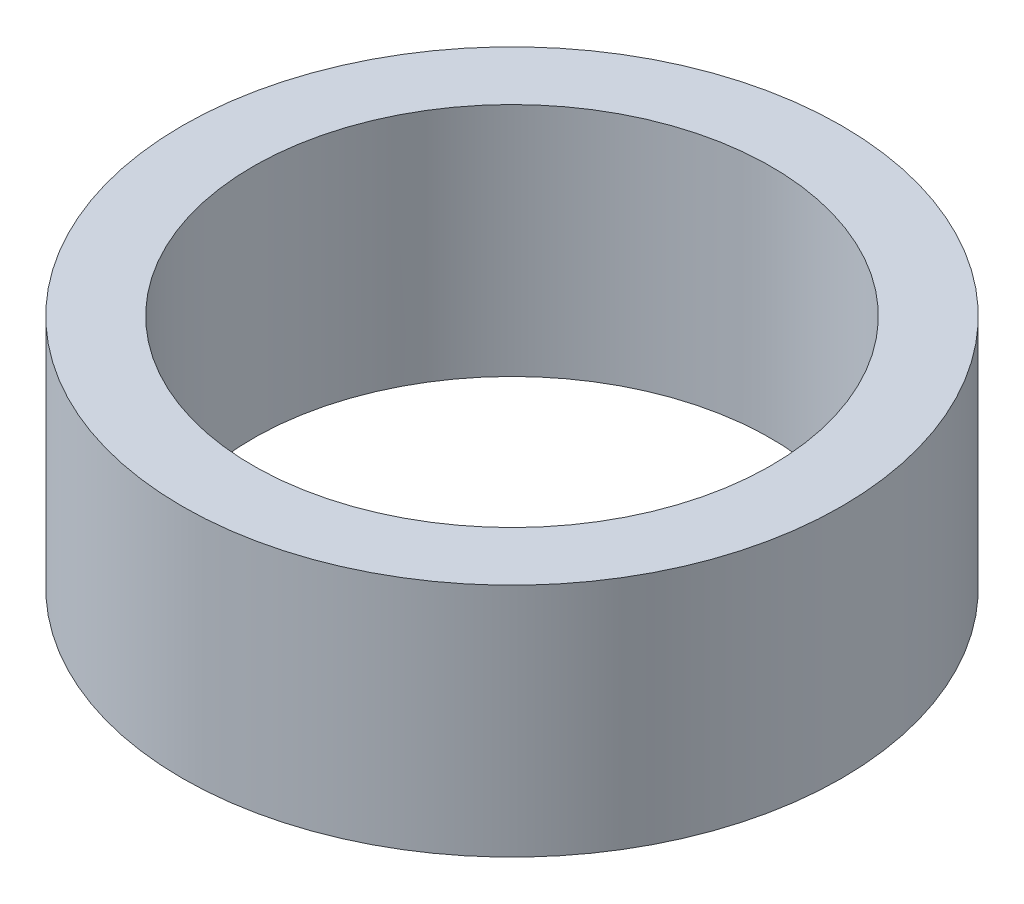
from build123d import *

# Parameters (mm, degrees)
BOSS_EXTRUDE1_OUTLINE_R   = 3.5
BOSS_EXTRUDE1_OUTLINE_R_2 = 2.75
BOSS_EXTRUDE1_DEPTH       = 2.5


# Read off the part's stored shape, not the designer's step: Boss-Extrude1
with BuildPart() as part:
    # Boss-Extrude1 outline → Boss-Extrude1 (new body)
    with BuildSketch(Plane(origin=(0, 0, 0), x_dir=(1, 0, 0), z_dir=(0, 1, 0))):
        with Locations((115.728029905, 107.796319891)):
            Circle(BOSS_EXTRUDE1_OUTLINE_R)
        with Locations((115.728029905, 107.796319891)):
            Circle(BOSS_EXTRUDE1_OUTLINE_R_2, mode=Mode.SUBTRACT)
    extrude(amount=BOSS_EXTRUDE1_DEPTH)


solid = part.part
